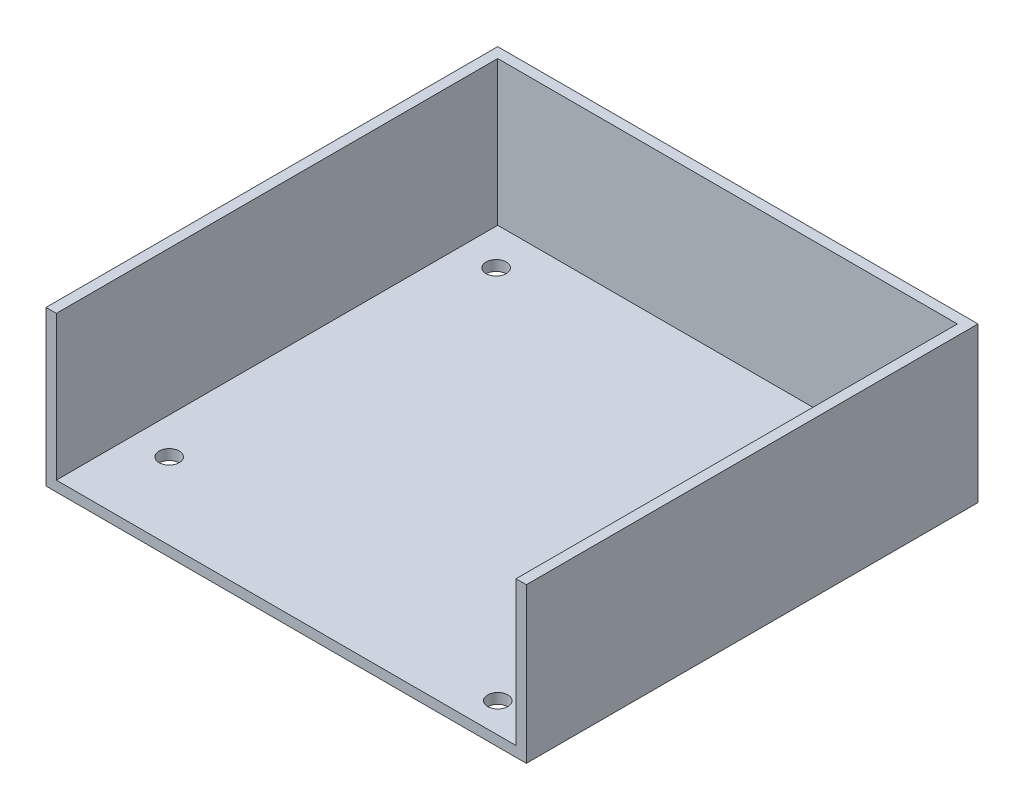
from build123d import *

# Parameters (mm, degrees)
SKETCH1_W           = 89.12
SKETCH1_H           = 85.57
BOSS_EXTRUDE1_DEPTH = 2
SKETCH3_W           = 2
SKETCH3_H           = 30
BOSS_EXTRUDE2_DEPTH = 85.57
SKETCH4_W           = 2
SKETCH4_H           = 30
BOSS_EXTRUDE3_DEPTH = 85.57
SKETCH5_W           = 93.12
SKETCH5_H           = 2
BOSS_EXTRUDE4_DEPTH = 30
SKETCH6_R           = 1.96
CUT_EXTRUDE2_DEPTH  = 30
SKETCH7_R           = 1.96
CUT_EXTRUDE3_DEPTH  = 30
SKETCH8_R           = 1.96
CUT_EXTRUDE4_DEPTH  = 30
SKETCH9_R           = 1.96
CUT_EXTRUDE5_DEPTH  = 30


with BuildPart() as part:
    # Sketch1 → Boss-Extrude1 (new body)
    with BuildSketch(Plane(origin=(0, 0, 0), x_dir=(1, 0, 0), z_dir=(0, 1, 0))):
        with Locations((44.56, 42.785)):
            Rectangle(SKETCH1_W, SKETCH1_H)
    extrude(amount=BOSS_EXTRUDE1_DEPTH)

    # Sketch3 → Boss-Extrude2 (add)
    with BuildSketch(Plane.XY):
        with Locations((-1, 15)):
            Rectangle(SKETCH3_W, SKETCH3_H)
    extrude(amount=-BOSS_EXTRUDE2_DEPTH)

    # Sketch4 → Boss-Extrude3 (add)
    with BuildSketch(Plane.XY):
        with Locations((90.12, 15)):
            Rectangle(SKETCH4_W, SKETCH4_H)
    extrude(amount=-BOSS_EXTRUDE3_DEPTH)

    # Sketch5 → Boss-Extrude4 (add)
    with BuildSketch(Plane(origin=(0, 0, 0), x_dir=(1, 0, 0), z_dir=(0, 1, 0))):
        with Locations((44.56, 86.57)):
            Rectangle(SKETCH5_W, SKETCH5_H)
    extrude(amount=BOSS_EXTRUDE4_DEPTH)

    # Sketch6 → Cut-Extrude2 (cut)
    with BuildSketch(Plane(origin=(0, 0, 0), x_dir=(1, 0, 0), z_dir=(0, 1, 0))):
        with Locations((79.835, 5.755)):
            Circle(SKETCH6_R)
    extrude(amount=CUT_EXTRUDE2_DEPTH, mode=Mode.SUBTRACT)

    # Sketch7 → Cut-Extrude3 (cut)
    with BuildSketch(Plane(origin=(0, 2, 0), x_dir=(1, 0, 0), z_dir=(0, 1, 0))):
        with Locations((82.285, 76.225)):
            Circle(SKETCH7_R)
    extrude(amount=-CUT_EXTRUDE3_DEPTH, mode=Mode.SUBTRACT)

    # Sketch8 → Cut-Extrude4 (cut)
    with BuildSketch(Plane(origin=(0, 0, 0), x_dir=(1, 0, 0), z_dir=(0, 1, 0))):
        with Locations((6.985, 78.28)):
            Circle(SKETCH8_R)
    extrude(amount=CUT_EXTRUDE4_DEPTH, mode=Mode.SUBTRACT)

    # Sketch9 → Cut-Extrude5 (cut)
    with BuildSketch(Plane(origin=(0, 2, 0), x_dir=(1, 0, 0), z_dir=(0, 1, 0))):
        with Locations((7.035, 14.85)):
            Circle(SKETCH9_R)
    extrude(amount=-CUT_EXTRUDE5_DEPTH, mode=Mode.SUBTRACT)


solid = part.part
